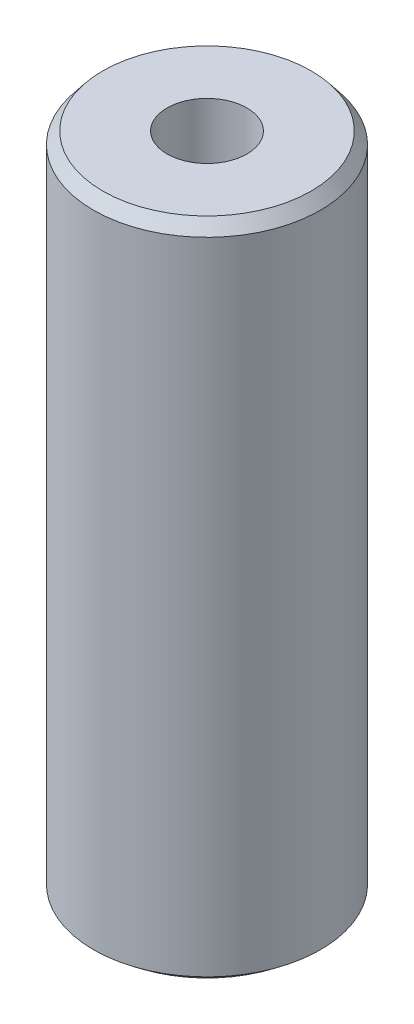
from build123d import *
from OCP.BRepFilletAPI import BRepFilletAPI_MakeChamfer

# Parameters (mm, degrees)
SKETCH1_R           = 45
BOSS_EXTRUDE1_DEPTH = 262.228788978
SKETCH2_R           = 15.820843679
CUT_EXTRUDE1_DEPTH  = 270.840578433
CHAMFER1_SIZE       = 4.695655562
CHAMFER1_SIZE2      = 3.714142538


with BuildPart() as part:
    # Sketch1 → Boss-Extrude1 (new body)
    with BuildSketch(Plane(origin=(0, 0, 0), x_dir=(1, 0, 0), z_dir=(0, 1, 0))):
        Circle(SKETCH1_R)
    extrude(amount=BOSS_EXTRUDE1_DEPTH)

    # Sketch2 → Cut-Extrude1 (cut, through all)
    with BuildSketch(Plane(origin=(0, 0, 0), x_dir=(1, 0, 0), z_dir=(0, 1, 0))):
        Circle(SKETCH2_R)
    extrude(amount=CUT_EXTRUDE1_DEPTH, mode=Mode.SUBTRACT)

    # Chamfer1: one chamfer whose edges measure the first distance from different faces: ONE call of the kernel's chamfer builder (chamfer() names one face for all edges)
    chamfer1_edges_1 = [part.edges().sort_by_distance(p)[0] for p in [
        (-45, 262.228788978, 0),
    ]]
    chamfer1_side_1 = [part.faces().sort_by_distance(p)[0] for p in [
        (-45, 131.114394489, 0),
    ]]
    chamfer1_edges_2 = [part.edges().sort_by_distance(p)[0] for p in [
        (-45, 0, 0),
    ]]
    chamfer1_side_2 = [part.faces().sort_by_distance(p)[0] for p in [
        (-43.727207794, 0, 0),
    ]]
    chamfer1 = BRepFilletAPI_MakeChamfer(part.part.solid().wrapped)
    for e in chamfer1_edges_1:
        chamfer1.Add(CHAMFER1_SIZE, CHAMFER1_SIZE2, e.wrapped, chamfer1_side_1[0].wrapped)  # the first distance lies on this face
    for e in chamfer1_edges_2:
        chamfer1.Add(CHAMFER1_SIZE, CHAMFER1_SIZE2, e.wrapped, chamfer1_side_2[0].wrapped)  # the first distance lies on this face
    add(Compound.cast(chamfer1.Shape()), mode=Mode.REPLACE)


solid = part.part
